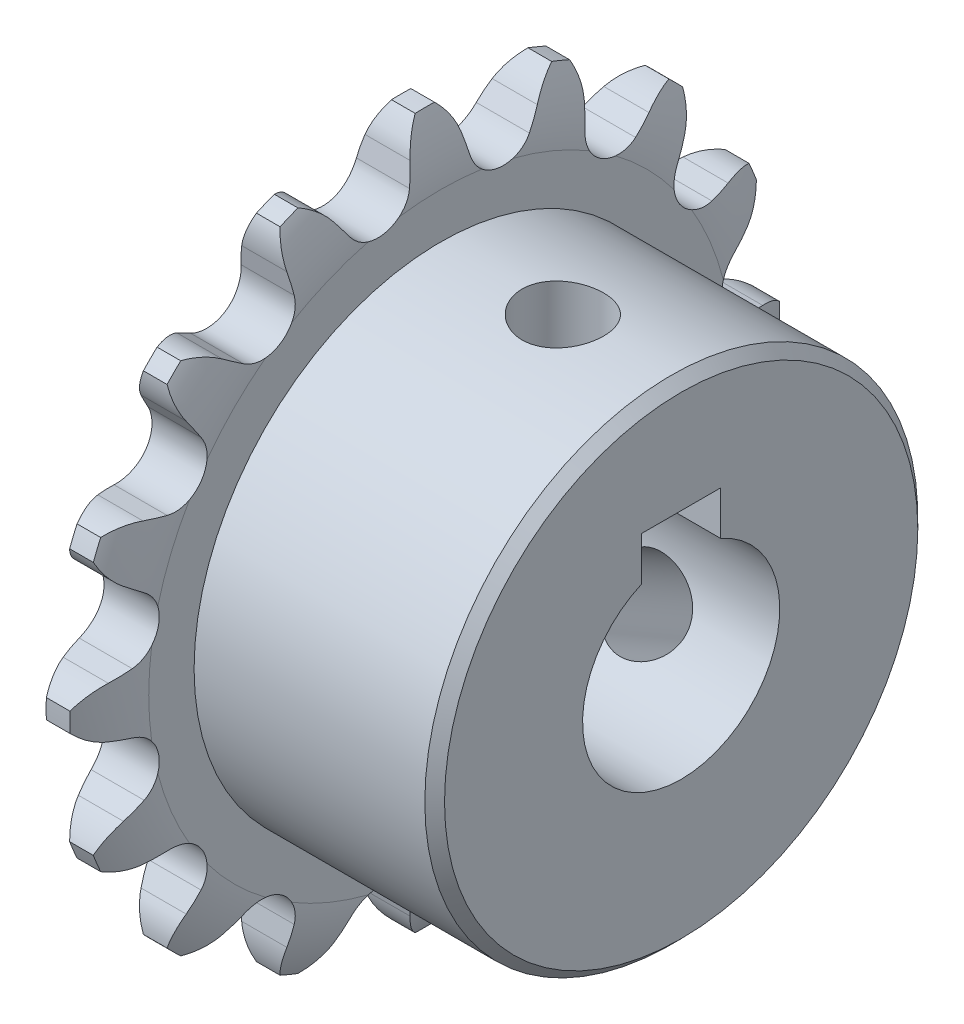
from build123d import *

# Parameters (mm, degrees)
TAP1_REACH         = 40.461
TAP1_BORE_R        = 2.067
TAP2_REACH         = 42.546
TAP2_BORE_R        = 2.067
SKETCH8_W          = 4
SKETCH8_H          = 6.8
CUT_EXTRUDE1_DEPTH = 30.546573456
CUT_EXTRUDE2_REACH = 31.547
CIRPATTERN1_DEPTH  = 2.8


# Read off the part's stored shape, not the designer's step: CirPattern1
with BuildPart() as part:
    # Sketch1 → Revolve1 (revolve)
    with BuildSketch(Plane.XY, mode=Mode.PRIVATE) as revolve1_sk:
        Polygon((0, 5), (0, 18), (2.8, 18), (2.8, 12.5), (15, 12.5), (15, 5), align=None)
    revolve(revolve1_sk.sketch.rotate(Axis((-0.851576533, 0, 0), (1, 0, 0)), 90), axis=Axis((-0.851576533, 0, 0), (1, 0, 0)))

    # Sketch2 → Cut-Revolve1 (revolve, cut)
    with BuildSketch(Plane.XY, mode=Mode.PRIVATE) as cut_revolve1_sk:
        with BuildLine():
            Line((0.8, 18), (0, 18))
            Line((0, 18), (0, 14.8))
            ThreePointArc((0, 14.8), (0.203030999, 16.44924225), (0.8, 18))
        make_face()
        with BuildLine():
            Line((2, 18), (2.8, 18))
            Line((2.8, 18), (2.8, 14.8))
            ThreePointArc((2.8, 14.8), (2.596969001, 16.44924225), (2, 18))
        make_face()
    revolve(cut_revolve1_sk.sketch.rotate(Axis((-0.851576533, 0, 0), (1, 0, 0)), 270), axis=Axis((-0.851576533, 0, 0), (1, 0, 0)), mode=Mode.SUBTRACT)

    # Sketch3 → Cut-Revolve2 (revolve, cut)
    with BuildSketch(Plane.XY, mode=Mode.PRIVATE) as cut_revolve2_sk:
        Polygon((15, 12.5), (14.5, 12.5), (15, 12), align=None)
    revolve(cut_revolve2_sk.sketch.rotate(Axis((-0.851576533, 0, 0), (1, 0, 0)), 90), axis=Axis((-0.851576533, 0, 0), (1, 0, 0)), mode=Mode.SUBTRACT)

    # Tap1 bore → Tap1 (cut, up to next)
    with BuildSketch(Plane(origin=(0, 12.5, 0), x_dir=(1, 0, 0), z_dir=(0, 1, 0)), mode=Mode.PRIVATE) as tap1_sk1:
        with Locations((9, 0)):
            Circle(TAP1_BORE_R)
    tap1_tool1 = extrude(tap1_sk1.sketch, amount=-TAP1_REACH, mode=Mode.PRIVATE) & part.part
    add(tap1_tool1.solids().sort_by_distance((9, 12.5, 0))[0], mode=Mode.SUBTRACT)

    # Tap2 bore → Tap2 (cut, up to next)
    with BuildSketch(Plane(origin=(0, -6.25, -10.825317547), x_dir=(1, 0, 0), z_dir=(0, -0.49999999999999495, -0.8660254037844416)), mode=Mode.PRIVATE) as tap2_sk1:
        with Locations((9, 0)):
            Circle(TAP2_BORE_R)
    tap2_tool1 = extrude(tap2_sk1.sketch, amount=-TAP2_REACH, mode=Mode.PRIVATE) & part.part
    add(tap2_tool1.solids().sort_by_distance((9, -6.25, -10.825318))[0], mode=Mode.SUBTRACT)

    # Sketch8 → Cut-Extrude1 (cut, through all)
    with BuildSketch(Plane(origin=(15, 0, 0), x_dir=(0, 0, -1), z_dir=(1, 0, 0))):
        with Locations((0, 3.4)):
            Rectangle(SKETCH8_W, SKETCH8_H)
    extrude(amount=-CUT_EXTRUDE1_DEPTH, mode=Mode.SUBTRACT)

    # Sketch9 → Cut-Extrude2 (cut, up to next)
    with BuildSketch(Plane(origin=(0, 0, 0), x_dir=(0, 0, -1), z_dir=(1, 0, 0)), mode=Mode.PRIVATE) as cut_extrude2_sk1:
        with BuildLine():
            Line((5.159547848, 15.823352036), (4.556038439, 14.97726305))
            ThreePointArc((4.556038439, 14.97726305), (2.844173032, 14.298623407), (1.522319768, 15.580707213))
            Line((1.522319768, 15.580707213), (1.288534015, 16.593344562))
            ThreePointArc((1.288534015, 16.593344562), (0.992083118, 17.351891786), (0.490243091, 17.993322698))
            ThreePointArc((0.490243091, 17.993322698), (3.511625796, 17.654135047), (6.432820932, 16.811270471))
            ThreePointArc((6.432820932, 16.811270471), (5.72371622, 16.410711444), (5.159547848, 15.823352036))
        make_face()
    cut_extrude2_tool1 = extrude(cut_extrude2_sk1.sketch, amount=CUT_EXTRUDE2_REACH, mode=Mode.PRIVATE) & part.part
    add(cut_extrude2_tool1.solids().sort_by_distance((0, 16.258448, -3.234006))[0], mode=Mode.SUBTRACT)

    # CirPattern1 outline → CirPattern1 (cut)
    with BuildSketch(Plane.YZ):
        with BuildLine():
            ThreePointArc((13.069854706, -12.376546285), (14.966453021, -10.000264194), (16.436054656, -7.338672042))
            ThreePointArc((16.436054656, -7.338672042), (15.651403903, -7.556846793), (14.837150797, -7.540448255))
            Line((14.837150797, -7.540448255), (13.812129943, -7.368918591))
            ThreePointArc((13.812129943, -7.368918591), (12.12178761, -8.099519535), (12.093666358, -9.940781096))
            Line((12.093666358, -9.940781096), (12.644397602, -10.822135322))
            ThreePointArc((12.644397602, -10.822135322), (12.97114905, -11.568131652), (13.069854706, -12.376546285))
        make_face()
        with BuildLine():
            ThreePointArc((17.993322698, 0.49024309), (17.654135047, 3.511625799), (16.81127047, 6.432820937))
            ThreePointArc((16.81127047, 6.432820937), (16.410711447, 5.723716223), (15.823352036, 5.159547848))
            Line((15.823352036, 5.159547848), (14.977263052, 4.55603844))
            ThreePointArc((14.977263052, 4.55603844), (14.298623407, 2.844173033), (15.580707214, 1.522319768))
            Line((15.580707214, 1.522319768), (16.59334456, 1.288534016))
            ThreePointArc((16.59334456, 1.288534016), (17.351891786, 0.992083118), (17.993322698, 0.49024309))
        make_face()
        with BuildLine():
            ThreePointArc((16.436054657, 7.338672042), (14.966453022, 10.000264194), (13.069854707, 12.376546286))
            ThreePointArc((13.069854707, 12.376546286), (12.97114905, 11.568131652), (12.644397602, 10.822135322))
            Line((12.644397602, 10.822135322), (12.093666358, 9.940781096))
            ThreePointArc((12.093666358, 9.940781096), (12.12178761, 8.099519535), (13.812129943, 7.368918591))
            Line((13.812129943, 7.368918591), (14.837150797, 7.540448255))
            ThreePointArc((14.837150797, 7.540448255), (15.651403903, 7.556846793), (16.436054657, 7.338672042))
        make_face()
        with BuildLine():
            ThreePointArc((12.376546286, 13.069854707), (10.000264194, 14.966453022), (7.338672042, 16.436054657))
            ThreePointArc((7.338672042, 16.436054657), (7.556846793, 15.651403903), (7.540448255, 14.837150797))
            Line((7.540448255, 14.837150797), (7.368918591, 13.812129943))
            ThreePointArc((7.368918591, 13.812129943), (8.099519535, 12.12178761), (9.940781096, 12.093666358))
            Line((9.940781096, 12.093666358), (10.822135322, 12.644397602))
            ThreePointArc((10.822135322, 12.644397602), (11.568131652, 12.97114905), (12.376546286, 13.069854707))
        make_face()
        with BuildLine():
            ThreePointArc((6.432820937, 16.81127047), (3.511625798, 17.654135048), (0.490243088, 17.993322699))
            ThreePointArc((0.490243088, 17.993322699), (0.992083117, 17.351891787), (1.288534016, 16.59334456))
            Line((1.288534016, 16.59334456), (1.522319768, 15.580707214))
            ThreePointArc((1.522319768, 15.580707214), (2.844173033, 14.298623407), (4.55603844, 14.977263052))
            Line((4.55603844, 14.977263052), (5.159547848, 15.823352036))
            ThreePointArc((5.159547848, 15.823352036), (5.723716223, 16.410711447), (6.432820937, 16.81127047))
        make_face()
        with BuildLine():
            ThreePointArc((-0.490243088, 17.993322699), (-3.511625798, 17.654135048), (-6.432820937, 16.81127047))
            ThreePointArc((-6.432820937, 16.81127047), (-5.723716223, 16.410711447), (-5.159547848, 15.823352036))
            Line((-5.159547848, 15.823352036), (-4.55603844, 14.977263052))
            ThreePointArc((-4.55603844, 14.977263052), (-2.844173033, 14.298623407), (-1.522319768, 15.580707214))
            Line((-1.522319768, 15.580707214), (-1.288534016, 16.59334456))
            ThreePointArc((-1.288534016, 16.59334456), (-0.992083117, 17.351891787), (-0.490243088, 17.993322699))
        make_face()
        with BuildLine():
            ThreePointArc((-7.338672042, 16.436054657), (-10.000264194, 14.966453022), (-12.376546286, 13.069854706))
            ThreePointArc((-12.376546286, 13.069854706), (-11.568131652, 12.97114905), (-10.822135322, 12.644397602))
            Line((-10.822135322, 12.644397602), (-9.940781096, 12.093666358))
            ThreePointArc((-9.940781096, 12.093666358), (-8.099519535, 12.12178761), (-7.368918591, 13.812129943))
            Line((-7.368918591, 13.812129943), (-7.540448255, 14.837150797))
            ThreePointArc((-7.540448255, 14.837150797), (-7.556846793, 15.651403903), (-7.338672042, 16.436054657))
        make_face()
        with BuildLine():
            ThreePointArc((-13.069854706, 12.376546286), (-14.966453022, 10.000264194), (-16.436054656, 7.338672042))
            ThreePointArc((-16.436054656, 7.338672042), (-15.651403903, 7.556846793), (-14.837150797, 7.540448255))
            Line((-14.837150797, 7.540448255), (-13.812129943, 7.368918591))
            ThreePointArc((-13.812129943, 7.368918591), (-12.12178761, 8.099519535), (-12.093666358, 9.940781096))
            Line((-12.093666358, 9.940781096), (-12.644397602, 10.822135322))
            ThreePointArc((-12.644397602, 10.822135322), (-12.97114905, 11.568131652), (-13.069854706, 12.376546286))
        make_face()
        with BuildLine():
            ThreePointArc((-16.811270469, 6.432820937), (-17.654135047, 3.511625798), (-17.993322698, 0.49024309))
            ThreePointArc((-17.993322698, 0.49024309), (-17.351891786, 0.992083118), (-16.59334456, 1.288534016))
            Line((-16.59334456, 1.288534016), (-15.580707214, 1.522319768))
            ThreePointArc((-15.580707214, 1.522319768), (-14.298623407, 2.844173033), (-14.977263052, 4.55603844))
            Line((-14.977263052, 4.55603844), (-15.823352036, 5.159547848))
            ThreePointArc((-15.823352036, 5.159547848), (-16.410711447, 5.723716223), (-16.811270469, 6.432820937))
        make_face()
        with BuildLine():
            ThreePointArc((-17.993322697, -0.49024309), (-17.654135046, -3.511625798), (-16.811270469, -6.432820937))
            ThreePointArc((-16.811270469, -6.432820937), (-16.410711447, -5.723716223), (-15.823352036, -5.159547848))
            Line((-15.823352036, -5.159547848), (-14.977263052, -4.55603844))
            ThreePointArc((-14.977263052, -4.55603844), (-14.298623407, -2.844173033), (-15.580707214, -1.522319768))
            Line((-15.580707214, -1.522319768), (-16.59334456, -1.288534016))
            ThreePointArc((-16.59334456, -1.288534016), (-17.351891786, -0.992083118), (-17.993322697, -0.49024309))
        make_face()
        with BuildLine():
            ThreePointArc((-16.436054655, -7.338672042), (-14.966453021, -10.000264193), (-13.069854706, -12.376546285))
            ThreePointArc((-13.069854706, -12.376546285), (-12.97114905, -11.568131652), (-12.644397602, -10.822135322))
            Line((-12.644397602, -10.822135322), (-12.093666358, -9.940781096))
            ThreePointArc((-12.093666358, -9.940781096), (-12.12178761, -8.099519535), (-13.812129943, -7.368918591))
            Line((-13.812129943, -7.368918591), (-14.837150797, -7.540448255))
            ThreePointArc((-14.837150797, -7.540448255), (-15.651403903, -7.556846793), (-16.436054655, -7.338672042))
        make_face()
        with BuildLine():
            ThreePointArc((-12.376546285, -13.069854706), (-10.000264193, -14.966453021), (-7.338672041, -16.436054655))
            ThreePointArc((-7.338672041, -16.436054655), (-7.556846793, -15.651403903), (-7.540448255, -14.837150797))
            Line((-7.540448255, -14.837150797), (-7.368918591, -13.812129943))
            ThreePointArc((-7.368918591, -13.812129943), (-8.099519535, -12.12178761), (-9.940781096, -12.093666358))
            Line((-9.940781096, -12.093666358), (-10.822135322, -12.644397602))
            ThreePointArc((-10.822135322, -12.644397602), (-11.568131652, -12.97114905), (-12.376546285, -13.069854706))
        make_face()
        with BuildLine():
            ThreePointArc((-6.432820937, -16.811270468), (-3.511625797, -17.654135046), (-0.490243088, -17.993322697))
            ThreePointArc((-0.490243088, -17.993322697), (-0.992083117, -17.351891787), (-1.288534016, -16.59334456))
            Line((-1.288534016, -16.59334456), (-1.522319768, -15.580707214))
            ThreePointArc((-1.522319768, -15.580707214), (-2.844173033, -14.298623407), (-4.55603844, -14.977263052))
            Line((-4.55603844, -14.977263052), (-5.159547848, -15.823352036))
            ThreePointArc((-5.159547848, -15.823352036), (-5.723716223, -16.410711447), (-6.432820937, -16.811270468))
        make_face()
        with BuildLine():
            ThreePointArc((0.490243088, -17.993322697), (3.511625797, -17.654135046), (6.432820937, -16.811270468))
            ThreePointArc((6.432820937, -16.811270468), (5.723716223, -16.410711447), (5.159547848, -15.823352036))
            Line((5.159547848, -15.823352036), (4.55603844, -14.977263052))
            ThreePointArc((4.55603844, -14.977263052), (2.844173033, -14.298623407), (1.522319768, -15.580707214))
            Line((1.522319768, -15.580707214), (1.288534016, -16.59334456))
            ThreePointArc((1.288534016, -16.59334456), (0.992083117, -17.351891787), (0.490243088, -17.993322697))
        make_face()
        with BuildLine():
            ThreePointArc((7.338672042, -16.436054655), (10.000264194, -14.966453021), (12.376546285, -13.069854706))
            ThreePointArc((12.376546285, -13.069854706), (11.568131652, -12.97114905), (10.822135322, -12.644397602))
            Line((10.822135322, -12.644397602), (9.940781096, -12.093666358))
            ThreePointArc((9.940781096, -12.093666358), (8.099519535, -12.12178761), (7.368918591, -13.812129943))
            Line((7.368918591, -13.812129943), (7.540448255, -14.837150797))
            ThreePointArc((7.540448255, -14.837150797), (7.556846793, -15.651403903), (7.338672042, -16.436054655))
        make_face()
    extrude(amount=CIRPATTERN1_DEPTH, mode=Mode.SUBTRACT)


solid = part.part
